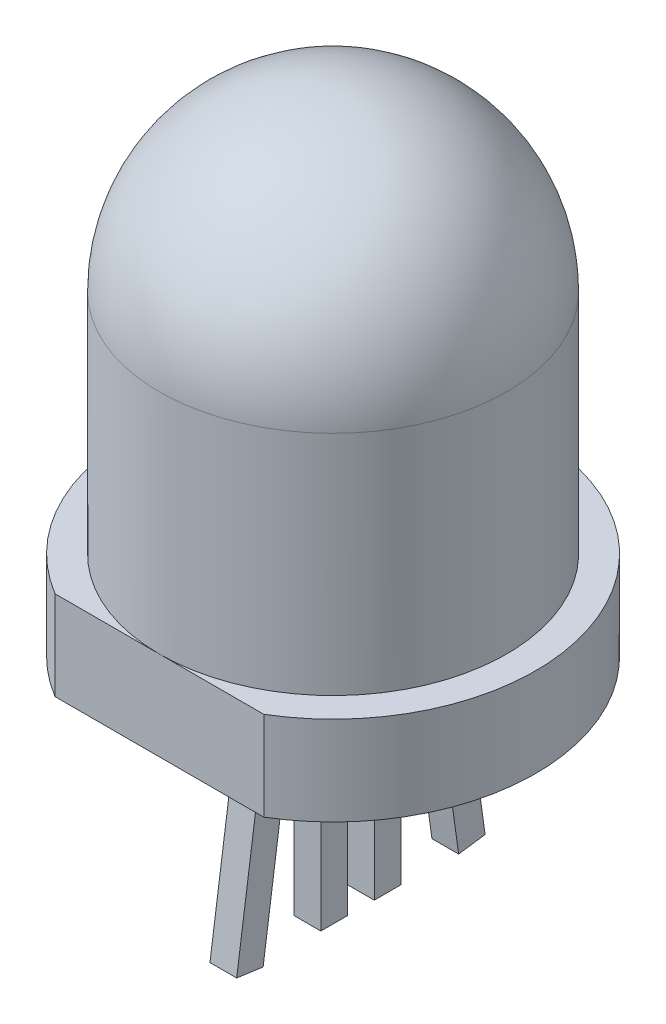
from build123d import *

# Parameters (mm, degrees)
ESQUISSE1_R        = 3.9
BOSS_EXTRU_1_DEPTH = 9
CONG_1_R           = 3.9
BOSS_EXTRU_2_DEPTH = 2
ESQUISSE3_W        = 0.6
ESQUISSE3_H        = 0.6
BOSS_EXTRU_3_DEPTH = 4.9
ESQUISSE6_W        = 0.6
ESQUISSE6_H        = 0.6
BOSS_EXTRU_4_DEPTH = 5
ESQUISSE8_W        = 0.6
ESQUISSE8_H        = 0.6
BOSS_EXTRU_5_DEPTH = 5


with BuildPart() as part:
    # Esquisse1 → Boss.-Extru.1 (new body)
    with BuildSketch(Plane(origin=(0, 0, 0), x_dir=(1, 0, 0), z_dir=(0, 1, 0))):
        Circle(ESQUISSE1_R)
    extrude(amount=BOSS_EXTRU_1_DEPTH)

    # Congé1
    cong_1_edges = [part.edges().sort_by_distance(p)[0] for p in [
        (-3.9, 9, 0),
    ]]
    fillet(cong_1_edges, radius=CONG_1_R)

    # Esquisse2 → Boss.-Extru.2 (add)
    with BuildSketch(Plane.XZ):
        with BuildLine():
            Line((2.343608329, 3.9), (-2.343608329, 3.9))
            ThreePointArc((-2.343608329, 3.9), (0, -4.55), (2.343608329, 3.9))
        make_face()
    extrude(amount=BOSS_EXTRU_2_DEPTH)

    # Esquisse3 → Boss.-Extru.3 (add)
    with BuildSketch(Plane.XZ.offset(2)):
        with Locations((0, 0.275)):
            Rectangle(ESQUISSE3_W, ESQUISSE3_H)
        with Locations((0, -0.925)):
            Rectangle(ESQUISSE3_W, ESQUISSE3_H)
    extrude(amount=BOSS_EXTRU_3_DEPTH)

    # Esquisse6 → Boss.-Extru.4 (add)
    with BuildSketch(Plane(origin=(0, -2.123198642, 0.298396109), x_dir=(-1, 0, 0), z_dir=(0, -0.9902680687415703, 0.13917310096006574))):
        with Locations((0, -1.185218779)):
            Rectangle(ESQUISSE6_W, ESQUISSE6_H)
    extrude(amount=BOSS_EXTRU_4_DEPTH)

    # Esquisse8 → Boss.-Extru.5 (add)
    with BuildSketch(Plane(origin=(0, -2.212780783, -0.310986058), x_dir=(-1, 0, 0), z_dir=(0, -0.9902680687415703, -0.13917310096006608))):
        with Locations((0, 1.828893024)):
            Rectangle(ESQUISSE8_W, ESQUISSE8_H)
    extrude(amount=BOSS_EXTRU_5_DEPTH)


solid = part.part
